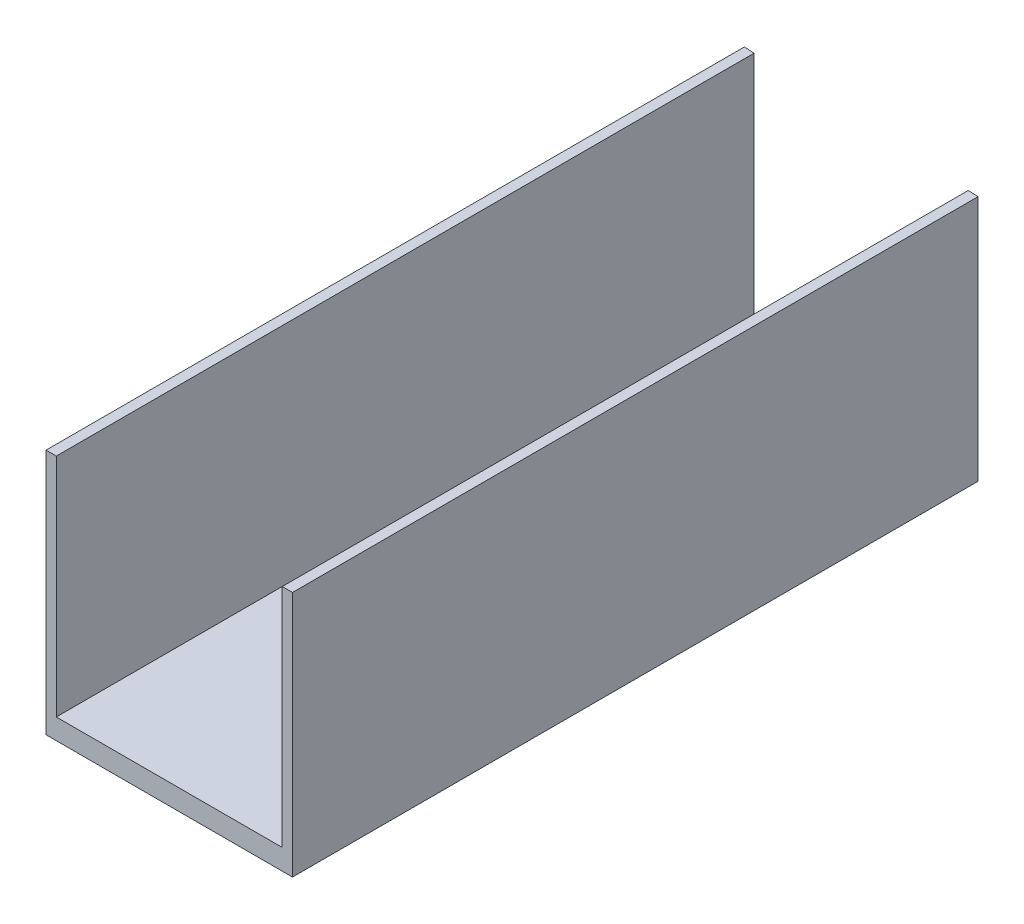
from build123d import *

# Parameters (mm, degrees)
BOSS_EXTRUDE1_DEPTH = 107.95
CUT_EXTRUDE1_DEPTH  = 98.425


with BuildPart() as part:
    # Sketch1 → Boss-Extrude1 (new body)
    with BuildSketch(Plane.XY):
        Polygon((18.371241491, 0), (-19.728758509, 0), (-19.728758509, 38.1), (-18.141258509, 38.1), (-18.141258509, 3.175), (16.783741491, 3.175), (16.783741491, 38.1), (18.371241491, 38.1), align=None)
    extrude(amount=BOSS_EXTRUDE1_DEPTH)

    # Sketch2 → Cut-Extrude1 (cut)
    with BuildSketch(Plane(origin=(0, 38.1, 0), x_dir=(1, 0, 0), z_dir=(0, 1, 0))):
        Polygon((-19.728758509, 0), (18.371241491, 0), (18.371241491, -1.996736391), align=None)
    extrude(amount=-CUT_EXTRUDE1_DEPTH, mode=Mode.SUBTRACT)


solid = part.part
